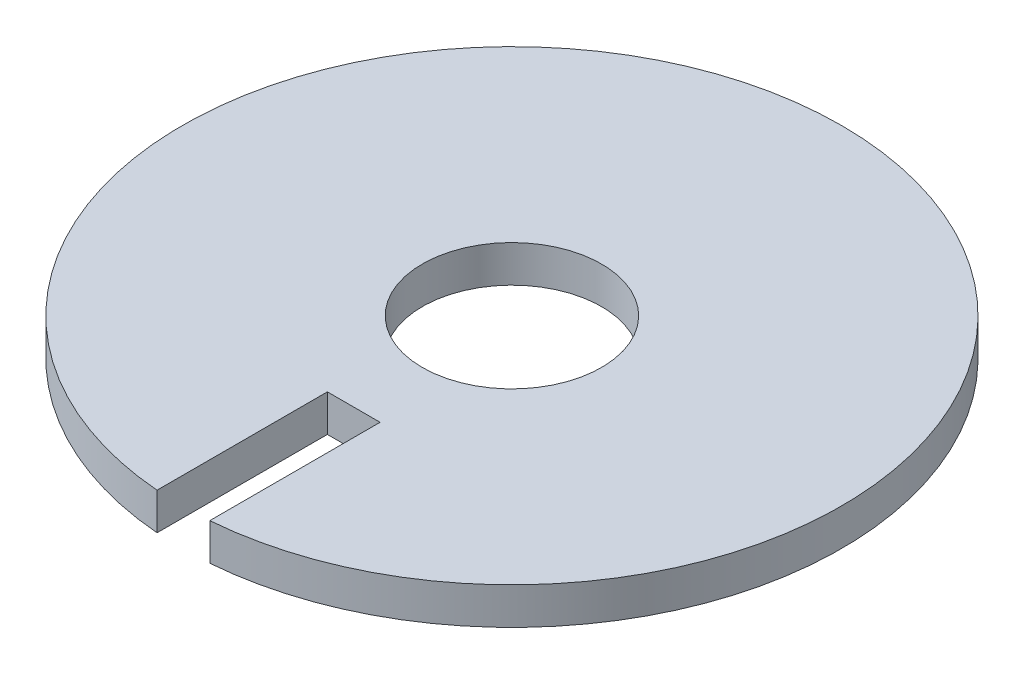
from build123d import *

# Parameters (mm, degrees)
SKETCH1_R          = 6.25
BASE_FLANGE1_DEPTH = 0.7
SKETCH4_W          = 1
SKETCH4_H          = 3.25
CUT_EXTRUDE1_DEPTH = 0.7
SKETCH5_R          = 1.7
CUT_EXTRUDE2_DEPTH = 0.7


# Sheet-metal steps are written as plain solids
with BuildPart() as part:
    # Sketch1 → Base-Flange1 (new body)
    with BuildSketch(Plane(origin=(0, 0, 0), x_dir=(1, 0, 0), z_dir=(0, 1, 0))):
        with Locations(Location((0, 0, 0), (0, 0, 270))):
            Circle(SKETCH1_R)
    extrude(amount=-BASE_FLANGE1_DEPTH)

    # Sketch4 → Cut-Extrude1 (cut)
    with BuildSketch(Plane(origin=(0, 0, 0), x_dir=(1, 0, 0), z_dir=(0, 1, 0))):
        with Locations((0, -4.625)):
            Rectangle(SKETCH4_W, SKETCH4_H)
    extrude(amount=-CUT_EXTRUDE1_DEPTH, mode=Mode.SUBTRACT)

    # Sketch5 → Cut-Extrude2 (cut)
    with BuildSketch(Plane(origin=(0, 0, 0), x_dir=(1, 0, 0), z_dir=(0, 1, 0))):
        with Locations(Location((0, 0, 0), (0, 0, 270))):
            Circle(SKETCH5_R)
    extrude(amount=-CUT_EXTRUDE2_DEPTH, mode=Mode.SUBTRACT)


solid = part.part
